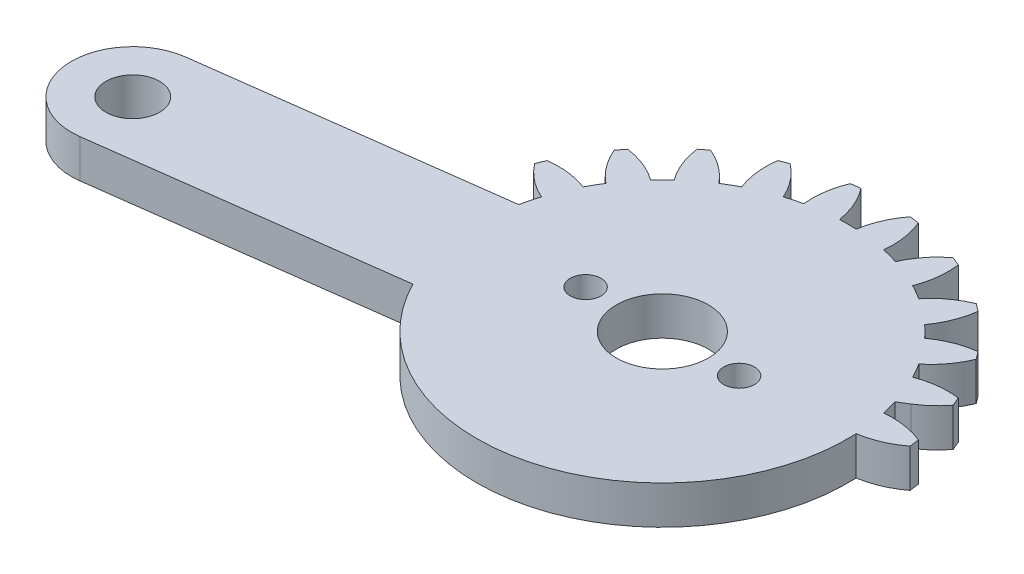
from build123d import *
from build123d.topology import SkipClean

# Parameters (mm, degrees)
SKETCH1_R           = 1.5
BOSS_EXTRUDE1_DEPTH = 2.5
BOSS_EXTRUDE2_START = -2.5
SKETCH3_R           = 1.5
SKETCH3_R_2         = 1.75
BOSS_EXTRUDE2_DEPTH = 2.5
CUT_EXTRUDE1_START  = -4
CUT_EXTRUDE1_DEPTH  = 4
CUT_EXTRUDE2_REACH  = 48.97
SKETCH5_R           = 3
SKETCH5_R_2         = 1


with BuildPart() as part:
    # Sketch1 → Boss-Extrude1 (new body)
    with BuildSketch(Plane(origin=(0, 0, 0), x_dir=(1, 0, 0), z_dir=(0, 1, 0))):
        with BuildLine():
            Line((20.643657446, 4), (2.081641936, 4))
            ThreePointArc((2.081641936, 4), (2.861028333, 4.588201733), (3.521749436, 5.30713988))
            ThreePointArc((3.521749436, 5.30713988), (3.405395609, 5.596745198), (3.282888305, 5.883801663))
            ThreePointArc((3.282888305, 5.883801663), (1.93527598, 5.894040025), (0.627094961, 5.57027124))
            ThreePointArc((0.627094961, 5.57027124), (0.366286148, 6.046375), (0.084372603, 6.510293938))
            ThreePointArc((0.084372603, 6.510293938), (1.018855105, 7.48132754), (1.683794586, 8.65351323))
            ThreePointArc((1.683794586, 8.65351323), (1.496450048, 8.903135899), (1.303821399, 9.148703928))
            ThreePointArc((1.303821399, 9.148703928), (-0.000522033, 8.809805691), (-1.180330337, 8.158486898))
            ThreePointArc((-1.180330337, 8.158486898), (-1.555477026, 8.550865528), (-1.947855656, 8.926012217))
            ThreePointArc((-1.947855656, 8.926012217), (-1.296536862, 10.105820521), (-0.957638625, 11.410163953))
            ThreePointArc((-0.957638625, 11.410163953), (-1.203206655, 11.602792602), (-1.452829324, 11.79013714))
            ThreePointArc((-1.452829324, 11.79013714), (-2.625015014, 11.125197659), (-3.596048616, 10.190715157))
            ThreePointArc((-3.596048616, 10.190715157), (-4.059967554, 10.472628702), (-4.536071314, 10.733437515))
            ThreePointArc((-4.536071314, 10.733437515), (-4.212302529, 12.041618533), (-4.222540891, 13.389230859))
            ThreePointArc((-4.222540891, 13.389230859), (-4.509597355, 13.511738163), (-4.799202674, 13.62809199))
            ThreePointArc((-4.799202674, 13.62809199), (-5.759348103, 12.682425791), (-6.455432668, 11.528463019))
            ThreePointArc((-6.455432668, 11.528463019), (-6.976508546, 11.680699536), (-7.503891752, 11.809396783))
            ThreePointArc((-7.503891752, 11.809396783), (-7.529737283, 13.156800143), (-7.888414517, 14.455843809))
            ThreePointArc((-7.888414517, 14.455843809), (-8.197396993, 14.499881098), (-8.507248835, 14.537314892))
            ThreePointArc((-8.507248835, 14.537314892), (-9.18992168, 13.375367565), (-9.563620196, 12.080565177))
            ThreePointArc((-9.563620196, 12.080565177), (-10.106342554, 12.09275), (-10.649064912, 12.080565177))
            ThreePointArc((-10.649064912, 12.080565177), (-11.022763428, 13.375367565), (-11.705436272, 14.537314892))
            ThreePointArc((-11.705436272, 14.537314892), (-12.015288115, 14.499881098), (-12.324270591, 14.455843809))
            ThreePointArc((-12.324270591, 14.455843809), (-12.682947825, 13.156800143), (-12.708793355, 11.809396783))
            ThreePointArc((-12.708793355, 11.809396783), (-13.236176561, 11.680699536), (-13.757252439, 11.528463019))
            ThreePointArc((-13.757252439, 11.528463019), (-14.453337005, 12.682425791), (-15.413482434, 13.62809199))
            ThreePointArc((-15.413482434, 13.62809199), (-15.703087752, 13.511738163), (-15.990144217, 13.389230859))
            ThreePointArc((-15.990144217, 13.389230859), (-16.000382579, 12.041618533), (-15.676613793, 10.733437515))
            ThreePointArc((-15.676613793, 10.733437515), (-16.152717554, 10.472628702), (-16.616636492, 10.190715157))
            ThreePointArc((-16.616636492, 10.190715157), (-17.587670094, 11.125197659), (-18.759855783, 11.79013714))
            ThreePointArc((-18.759855783, 11.79013714), (-19.009478453, 11.602792602), (-19.255046482, 11.410163953))
            ThreePointArc((-19.255046482, 11.410163953), (-18.916148245, 10.105820521), (-18.264829452, 8.926012217))
            ThreePointArc((-18.264829452, 8.926012217), (-18.657208082, 8.550865528), (-19.032354771, 8.158486898))
            ThreePointArc((-19.032354771, 8.158486898), (-20.212163074, 8.809805691), (-21.516506507, 9.148703928))
            ThreePointArc((-21.516506507, 9.148703928), (-21.709135156, 8.903135899), (-21.896479694, 8.65351323))
            ThreePointArc((-21.896479694, 8.65351323), (-21.231540213, 7.48132754), (-20.297057711, 6.510293938))
            ThreePointArc((-20.297057711, 6.510293938), (-20.578971255, 6.046375), (-20.839780068, 5.57027124))
            ThreePointArc((-20.839780068, 5.57027124), (-22.147961087, 5.894040025), (-23.495573413, 5.883801663))
            ThreePointArc((-23.495573413, 5.883801663), (-23.618080717, 5.596745198), (-23.734434544, 5.30713988))
            ThreePointArc((-23.734434544, 5.30713988), (-22.788768345, 4.346994451), (-21.634805572, 3.650909885))
            ThreePointArc((-21.634805572, 3.650909885), (-21.78704209, 3.129834008), (-21.915739337, 2.602450802))
            ThreePointArc((-21.915739337, 2.602450802), (-23.263142697, 2.576605271), (-24.562186363, 2.217928037))
            ThreePointArc((-24.562186363, 2.217928037), (-24.606223651, 1.908945561), (-24.643657446, 1.599093719))
            ThreePointArc((-24.643657446, 1.599093719), (-23.481710119, 0.916420874), (-22.186907731, 0.542722358))
            ThreePointArc((-22.186907731, 0.542722358), (-22.199092554, 0), (-22.186907731, -0.542722358))
            ThreePointArc((-22.186907731, -0.542722358), (-23.481710119, -0.916420874), (-24.643657446, -1.599093719))
            ThreePointArc((-24.643657446, -1.599093719), (-24.606223651, -1.908945561), (-24.562186363, -2.217928037))
            ThreePointArc((-24.562186363, -2.217928037), (-23.263142697, -2.576605271), (-21.915739337, -2.602450802))
            ThreePointArc((-21.915739337, -2.602450802), (-21.78704209, -3.129834008), (-21.634805572, -3.650909885))
            ThreePointArc((-21.634805572, -3.650909885), (-22.788768345, -4.346994451), (-23.734434544, -5.30713988))
            ThreePointArc((-23.734434544, -5.30713988), (-23.618080717, -5.596745198), (-23.495573413, -5.883801663))
            ThreePointArc((-23.495573413, -5.883801663), (-22.147961087, -5.894040025), (-20.839780068, -5.57027124))
            ThreePointArc((-20.839780068, -5.57027124), (-20.578971255, -6.046375), (-20.297057711, -6.510293938))
            ThreePointArc((-20.297057711, -6.510293938), (-21.231540213, -7.48132754), (-21.896479694, -8.65351323))
            ThreePointArc((-21.896479694, -8.65351323), (-21.709135156, -8.903135899), (-21.516506507, -9.148703928))
            ThreePointArc((-21.516506507, -9.148703928), (-20.212163074, -8.809805691), (-19.032354771, -8.158486898))
            ThreePointArc((-19.032354771, -8.158486898), (-18.657208082, -8.550865528), (-18.264829452, -8.926012217))
            ThreePointArc((-18.264829452, -8.926012217), (-18.916148245, -10.105820521), (-19.255046482, -11.410163953))
            ThreePointArc((-19.255046482, -11.410163953), (-19.009478453, -11.602792602), (-18.759855783, -11.79013714))
            ThreePointArc((-18.759855783, -11.79013714), (-17.587670094, -11.125197659), (-16.616636492, -10.190715157))
            ThreePointArc((-16.616636492, -10.190715157), (-16.152717554, -10.472628702), (-15.676613793, -10.733437515))
            ThreePointArc((-15.676613793, -10.733437515), (-16.000382579, -12.041618533), (-15.990144217, -13.389230859))
            ThreePointArc((-15.990144217, -13.389230859), (-15.703087752, -13.511738163), (-15.413482434, -13.62809199))
            ThreePointArc((-15.413482434, -13.62809199), (-14.453337005, -12.682425791), (-13.757252439, -11.528463019))
            ThreePointArc((-13.757252439, -11.528463019), (-13.236176561, -11.680699536), (-12.708793355, -11.809396783))
            ThreePointArc((-12.708793355, -11.809396783), (-12.682947825, -13.156800143), (-12.324270591, -14.455843809))
            ThreePointArc((-12.324270591, -14.455843809), (-12.015288115, -14.499881098), (-11.705436272, -14.537314892))
            ThreePointArc((-11.705436272, -14.537314892), (-11.022763428, -13.375367565), (-10.649064912, -12.080565177))
            ThreePointArc((-10.649064912, -12.080565177), (-10.106342554, -12.09275), (-9.563620196, -12.080565177))
            ThreePointArc((-9.563620196, -12.080565177), (-9.18992168, -13.375367565), (-8.507248835, -14.537314892))
            ThreePointArc((-8.507248835, -14.537314892), (-8.197396993, -14.499881098), (-7.888414517, -14.455843809))
            ThreePointArc((-7.888414517, -14.455843809), (-7.529737283, -13.156800143), (-7.503891752, -11.809396783))
            ThreePointArc((-7.503891752, -11.809396783), (-6.976508546, -11.680699536), (-6.455432668, -11.528463019))
            ThreePointArc((-6.455432668, -11.528463019), (-5.759348103, -12.682425791), (-4.799202674, -13.62809199))
            ThreePointArc((-4.799202674, -13.62809199), (-4.509597355, -13.511738163), (-4.222540891, -13.389230859))
            ThreePointArc((-4.222540891, -13.389230859), (-4.212302529, -12.041618533), (-4.536071314, -10.733437515))
            ThreePointArc((-4.536071314, -10.733437515), (-4.059967554, -10.472628702), (-3.596048616, -10.190715157))
            ThreePointArc((-3.596048616, -10.190715157), (-2.625015014, -11.125197659), (-1.452829324, -11.79013714))
            ThreePointArc((-1.452829324, -11.79013714), (-1.203206655, -11.602792602), (-0.957638625, -11.410163953))
            ThreePointArc((-0.957638625, -11.410163953), (-1.296536862, -10.105820521), (-1.947855656, -8.926012217))
            ThreePointArc((-1.947855656, -8.926012217), (-1.555477026, -8.550865528), (-1.180330337, -8.158486898))
            ThreePointArc((-1.180330337, -8.158486898), (-0.000522033, -8.809805691), (1.303821399, -9.148703928))
            ThreePointArc((1.303821399, -9.148703928), (1.496450048, -8.903135899), (1.683794586, -8.65351323))
            ThreePointArc((1.683794586, -8.65351323), (1.018855105, -7.48132754), (0.084372603, -6.510293938))
            ThreePointArc((0.084372603, -6.510293938), (0.366286148, -6.046375), (0.627094961, -5.57027124))
            ThreePointArc((0.627094961, -5.57027124), (1.93527598, -5.894040025), (3.282888305, -5.883801663))
            ThreePointArc((3.282888305, -5.883801663), (3.405395609, -5.596745198), (3.521749436, -5.30713988))
            ThreePointArc((3.521749436, -5.30713988), (2.861028333, -4.588201733), (2.081641936, -4))
            Line((2.081641936, -4), (20.643657446, -4))
            ThreePointArc((20.643657446, -4), (24.643657446, 0), (20.643657446, 4))
        make_face()
        with Locations((-10.106342554, 0)):
            Circle(SKETCH1_R, mode=Mode.SUBTRACT)
        with Locations((20.643657446, 0)):
            Circle(SKETCH1_R, mode=Mode.SUBTRACT)
    extrude(amount=BOSS_EXTRUDE1_DEPTH)

    # Sketch3 → Boss-Extrude2 (add)
    with BuildSketch(Plane(origin=(0, 2.5, 0), x_dir=(1, 0, 0), z_dir=(0, 1, 0)).offset(BOSS_EXTRUDE2_START)):
        with BuildLine():
            Line((-10.628447323, 3.965779445), (-41.11537681, -0.047900965))
            ThreePointArc((-41.11537681, -0.047900965), (-44.559051487, -4.53578518), (-40.071167272, -7.979459856))
            Line((-40.071167272, -7.979459856), (-9.584237785, -3.965779445))
            ThreePointArc((-9.584237785, -3.965779445), (-6.140563108, 0.522104769), (-10.628447323, 3.965779445))
        make_face()
        with Locations((-10.106342554, 0)):
            Circle(SKETCH3_R, mode=Mode.SUBTRACT)
        with Locations((-40.593272041, -4.013680411)):
            Circle(SKETCH3_R_2, mode=Mode.SUBTRACT)
    extrude(amount=BOSS_EXTRUDE2_DEPTH)

    # Sketch4 → Cut-Extrude1 (cut)
    with SkipClean():  # the faces are left unmerged after this step: merging them gives an invalid solid
        with BuildSketch(Plane(origin=(0, 2.5, 0), x_dir=(1, 0, 0), z_dir=(0, 1, 0)).offset(CUT_EXTRUDE1_START)):
            with BuildLine():
                ThreePointArc((20.643657446, -4), (24.643657446, 0), (20.643657446, 4))
                Line((20.643657446, 4), (2.081641936, 4))
                Line((2.081641936, 4), (1.43808022, 3.600125745))
                ThreePointArc((1.43808022, 3.600125745), (1.581217534, 3.104116905), (1.70305423, 2.602450802))
                ThreePointArc((1.70305423, 2.602450802), (3.050457589, 2.576605271), (4.349501255, 2.217928037))
                ThreePointArc((4.349501255, 2.217928037), (4.393538544, 1.908945561), (4.430972339, 1.599093719))
                ThreePointArc((4.430972339, 1.599093719), (3.269025011, 0.916420874), (1.974222624, 0.542722358))
                ThreePointArc((1.974222624, 0.542722358), (1.70305423, -2.602450802), (0.627094961, -5.57027124))
                ThreePointArc((0.627094961, -5.57027124), (1.93527598, -5.894040025), (3.282888305, -5.883801663))
                ThreePointArc((3.282888305, -5.883801663), (3.405395609, -5.596745198), (3.521749436, -5.30713988))
                ThreePointArc((3.521749436, -5.30713988), (2.861028333, -4.588201733), (2.081641936, -4))
                Line((2.081641936, -4), (20.643657446, -4))
            make_face()
            with BuildLine():
                ThreePointArc((1.683794586, -8.65351323), (1.018855105, -7.48132754), (0.084372603, -6.510293938))
                ThreePointArc((0.084372603, -6.510293938), (-0.512518948, -7.361599771), (-1.180330337, -8.158486898))
                ThreePointArc((-1.180330337, -8.158486898), (-0.000522033, -8.809805691), (1.303821399, -9.148703928))
                ThreePointArc((1.303821399, -9.148703928), (1.496450048, -8.903135899), (1.683794586, -8.65351323))
            make_face()
            with BuildLine():
                ThreePointArc((-0.957638625, -11.410163953), (-1.296536862, -10.105820521), (-1.947855656, -8.926012217))
                ThreePointArc((-1.947855656, -8.926012217), (-2.744742783, -9.593823606), (-3.596048616, -10.190715157))
                ThreePointArc((-3.596048616, -10.190715157), (-2.625015014, -11.125197659), (-1.452829324, -11.79013714))
                ThreePointArc((-1.452829324, -11.79013714), (-1.203206655, -11.602792602), (-0.957638625, -11.410163953))
            make_face()
            with BuildLine():
                ThreePointArc((-4.222540891, -13.389230859), (-4.212302529, -12.041618533), (-4.536071314, -10.733437515))
                ThreePointArc((-4.536071314, -10.733437515), (-5.478647477, -11.172244217), (-6.455432668, -11.528463019))
                ThreePointArc((-6.455432668, -11.528463019), (-5.759348103, -12.682425791), (-4.799202674, -13.62809199))
                ThreePointArc((-4.799202674, -13.62809199), (-4.509597355, -13.511738163), (-4.222540891, -13.389230859))
            make_face()
            with BuildLine():
                ThreePointArc((-7.888414517, -14.455843809), (-7.529737283, -13.156800143), (-7.503891752, -11.809396783))
                ThreePointArc((-7.503891752, -11.809396783), (-8.527921943, -11.989294847), (-9.563620196, -12.080565177))
                ThreePointArc((-9.563620196, -12.080565177), (-9.18992168, -13.375367565), (-8.507248835, -14.537314892))
                ThreePointArc((-8.507248835, -14.537314892), (-8.197396993, -14.499881098), (-7.888414517, -14.455843809))
            make_face()
            with BuildLine():
                ThreePointArc((-11.705436272, -14.537314892), (-11.022763428, -13.375367565), (-10.649064912, -12.080565177))
                ThreePointArc((-10.649064912, -12.080565177), (-11.684763165, -11.989294847), (-12.708793355, -11.809396783))
                ThreePointArc((-12.708793355, -11.809396783), (-12.682947825, -13.156800143), (-12.324270591, -14.455843809))
                ThreePointArc((-12.324270591, -14.455843809), (-12.015288115, -14.499881098), (-11.705436272, -14.537314892))
            make_face()
            with BuildLine():
                ThreePointArc((-15.413482434, -13.62809199), (-14.453337005, -12.682425791), (-13.757252439, -11.528463019))
                ThreePointArc((-13.757252439, -11.528463019), (-14.734037631, -11.172244217), (-15.676613793, -10.733437515))
                ThreePointArc((-15.676613793, -10.733437515), (-16.000382579, -12.041618533), (-15.990144217, -13.389230859))
                ThreePointArc((-15.990144217, -13.389230859), (-15.703087752, -13.511738163), (-15.413482434, -13.62809199))
            make_face()
            with BuildLine():
                ThreePointArc((-18.759855783, -11.79013714), (-17.587670094, -11.125197659), (-16.616636492, -10.190715157))
                ThreePointArc((-16.616636492, -10.190715157), (-17.467942324, -9.593823606), (-18.264829452, -8.926012217))
                ThreePointArc((-18.264829452, -8.926012217), (-18.916148245, -10.105820521), (-19.255046482, -11.410163953))
                ThreePointArc((-19.255046482, -11.410163953), (-19.009478453, -11.602792602), (-18.759855783, -11.79013714))
            make_face()
            with BuildLine():
                ThreePointArc((-21.516506507, -9.148703928), (-20.212163074, -8.809805691), (-19.032354771, -8.158486898))
                ThreePointArc((-19.032354771, -8.158486898), (-19.70016616, -7.361599771), (-20.297057711, -6.510293938))
                ThreePointArc((-20.297057711, -6.510293938), (-21.231540213, -7.48132754), (-21.896479694, -8.65351323))
                ThreePointArc((-21.896479694, -8.65351323), (-21.709135156, -8.903135899), (-21.516506507, -9.148703928))
            make_face()
            with BuildLine():
                ThreePointArc((-21.942853375, 2.47620963), (-21.92946485, 2.539366405), (-21.915739337, 2.602450802))
                ThreePointArc((-21.915739337, 2.602450802), (-23.263142697, 2.576605271), (-24.562186363, 2.217928037))
                ThreePointArc((-24.562186363, 2.217928037), (-24.56889027, 2.173784387), (-24.575459377, 2.129620475))
                Line((-24.575459377, 2.129620475), (-21.942853375, 2.47620963))
            make_face()
            with BuildLine():
                ThreePointArc((-23.495573413, -5.883801663), (-22.147961087, -5.894040025), (-20.839780068, -5.57027124))
                ThreePointArc((-20.839780068, -5.57027124), (-20.869365339, -5.512888815), (-20.898643838, -5.455349261))
                Line((-20.898643838, -5.455349261), (-23.531249839, -5.801938416))
                ThreePointArc((-23.531249839, -5.801938416), (-23.513474108, -5.842897269), (-23.495573413, -5.883801663))
            make_face()
        extrude(amount=CUT_EXTRUDE1_DEPTH, mode=Mode.SUBTRACT)

    # Sketch5 → Cut-Extrude2 (cut, up to next)
    with BuildSketch(Plane(origin=(0, 2.5, 0), x_dir=(1, 0, 0), z_dir=(0, 1, 0)), mode=Mode.PRIVATE) as cut_extrude2_sk1:
        with Locations((-10.106342554, 0)):
            Circle(SKETCH5_R)
    cut_extrude2_tool1 = extrude(cut_extrude2_sk1.sketch, amount=-CUT_EXTRUDE2_REACH, mode=Mode.PRIVATE) & part.part
    # Sketch5 → Cut-Extrude2 (cut, up to next)
    with BuildSketch(Plane(origin=(0, 2.5, 0), x_dir=(1, 0, 0), z_dir=(0, 1, 0)), mode=Mode.PRIVATE) as cut_extrude2_sk2:
        with Locations((-5.106342554, 0)):
            Circle(SKETCH5_R_2)
    cut_extrude2_tool2 = extrude(cut_extrude2_sk2.sketch, amount=-CUT_EXTRUDE2_REACH, mode=Mode.PRIVATE) & part.part
    # Sketch5 → Cut-Extrude2 (cut, up to next)
    with BuildSketch(Plane(origin=(0, 2.5, 0), x_dir=(1, 0, 0), z_dir=(0, 1, 0)), mode=Mode.PRIVATE) as cut_extrude2_sk3:
        with Locations((-15.106342554, 0)):
            Circle(SKETCH5_R_2)
    cut_extrude2_tool3 = extrude(cut_extrude2_sk3.sketch, amount=-CUT_EXTRUDE2_REACH, mode=Mode.PRIVATE) & part.part
    add(cut_extrude2_tool1.solids().sort_by_distance((-10.106343, 2.5, 0))[0], mode=Mode.SUBTRACT)
    add(cut_extrude2_tool2.solids().sort_by_distance((-5.106343, 2.5, 0))[0], mode=Mode.SUBTRACT)
    add(cut_extrude2_tool3.solids().sort_by_distance((-15.106343, 2.5, 0))[0], mode=Mode.SUBTRACT)


solid = part.part
